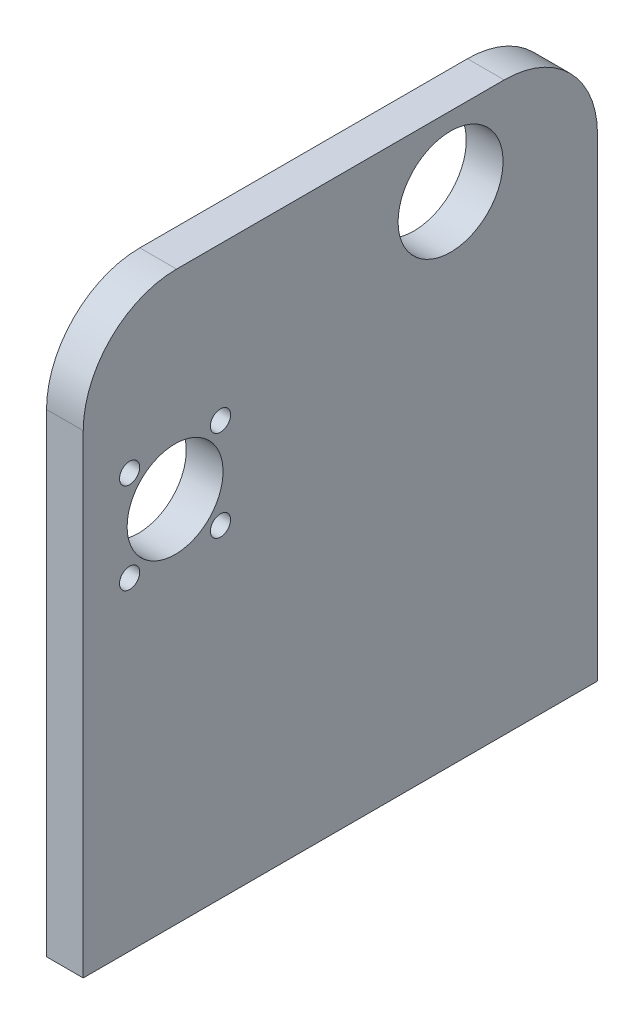
from build123d import *

# Parameters (mm, degrees)
SKETCH1_W           = 10
SKETCH1_H           = 140
BOSS_EXTRUDE1_DEPTH = 77.221817616
FILLET1_R           = 25.4
SKETCH3_R           = 14.29
SKETCH3_R_2         = 2.75
SKETCH3_R_3         = 13.0556
CUT_EXTRUDE2_DEPTH  = 28.575


with BuildPart() as part:
    # Sketch1 → Boss-Extrude1 (new, symmetric)
    with BuildSketch(Plane(origin=(0, 0, 0), x_dir=(1, 0, 0), z_dir=(0, 1, 0))):
        Rectangle(SKETCH1_W, SKETCH1_H)
    extrude(amount=BOSS_EXTRUDE1_DEPTH, both=True)

    # Fillet1
    fillet1_edges = [part.edges().sort_by_distance(p)[0] for p in [
        (0, 77.221817616, 70),
        (0, 77.221817616, -70),
    ]]
    fillet(fillet1_edges, radius=FILLET1_R)

    # Sketch3 → Cut-Extrude2 (cut)
    with BuildSketch(Plane.ZY.offset(5)):
        with Locations((-30, 58.171817616)):
            Circle(SKETCH3_R)
        with Locations((32.634154481, 35.541167111)):
            Circle(SKETCH3_R_2)
        with Locations((57.374792935, 35.541167111)):
            Circle(SKETCH3_R_2)
        with Locations((32.634154481, 10.797024681)):
            Circle(SKETCH3_R_2)
        with Locations((57.374792935, 10.797024681)):
            Circle(SKETCH3_R_2)
        with Locations((45, 23.171817616)):
            Circle(SKETCH3_R_3)
    extrude(amount=-CUT_EXTRUDE2_DEPTH, mode=Mode.SUBTRACT)


solid = part.part
